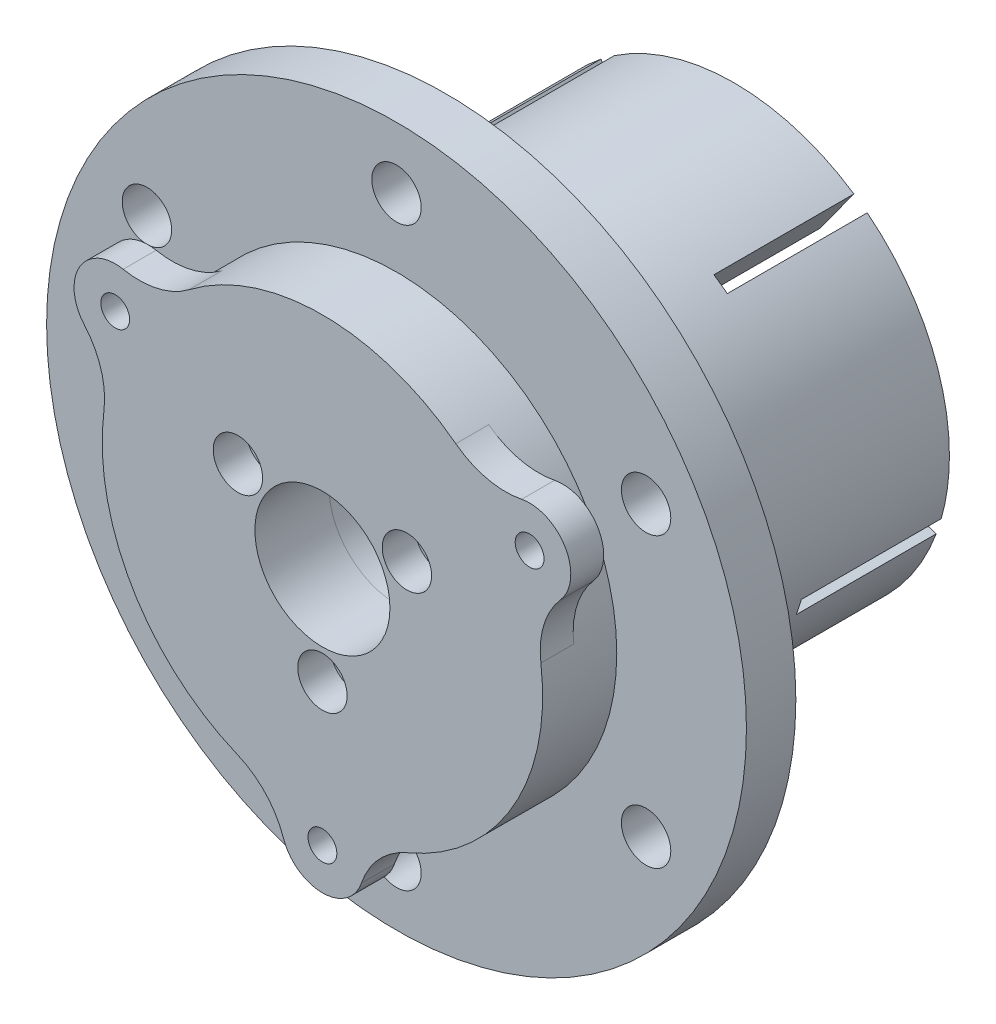
from build123d import *

# Parameters (mm, degrees)
SKETCH1_R               = 26.15
SKETCH1_R_2             = 19.15
BOSS_EXTRUDE1_DEPTH     = 35
FILLET1_R               = 0.7
SKETCH2_R               = 42.5
SKETCH2_R_2             = 3
SKETCH2_R_3             = 8.2
SKETCH2_R_4             = 1.35
BOSS_EXTRUDE2_DEPTH     = 6
SKETCH3_W               = 2
SKETCH3_H               = 27.522885867
CUT_EXTRUDE1_DEPTH      = 17
CIRPATTERN1_COUNT       = 5
CHAMFER1_SIZE           = 8
SKETCH4_R               = 8
CUT_EXTRUDE2_DEPTH      = 70.552138716
SKETCH7_R               = 2.4
CUT_EXTRUDE3_DEPTH      = 3
CHAMFER2_SIZE           = 0.923009594
CHAMFER2_SIZE_2         = 1.1
SKETCH9_R               = 26.75
SKETCH9_R_2             = 2.4
SKETCH9_R_3             = 8.2
SKETCH9_R_4             = 1.75
BOSS_EXTRUDE3_DEPTH     = 9
SHELL1_T                = -4
BOSS_EXTRUDE4_START     = 5
BOSS_EXTRUDE4_OUTLINE_R = 1.75
BOSS_EXTRUDE4_DEPTH     = 4
FILLET2_R               = 10
SKETCH10_R              = 3
CUT_EXTRUDE4_DEPTH      = 4


# Read off the part's stored shape, not the designer's step: Boss-Extrude4
with BuildPart() as part:
    # Sketch1 → Boss-Extrude1 (new body)
    # profile 1 of 3: a face of its own
    with BuildSketch(Plane.XY):
        Circle(SKETCH1_R)
        Circle(SKETCH1_R_2, mode=Mode.SUBTRACT)
    # profile 2 of 3: a face of its own
    with BuildSketch(Plane.XY):
        with BuildLine():
            Line((2.9, 18.929144196), (-2.9, 18.929144196))
            Line((-2.9, 18.929144196), (-2.9, 16.750820875))
            ThreePointArc((-2.9, 16.750820875), (0, 17), (2.9, 16.750820875))
            Line((2.9, 16.750820875), (2.9, 18.929144196))
        make_face()
    # profile 3 of 3: a face of its own
    with BuildSketch(Plane.XY):
        with BuildLine():
            ThreePointArc((2.9, 18.929144196), (0, 19.15), (-2.9, 18.929144196))
            Line((-2.9, 18.929144196), (2.9, 18.929144196))
        make_face()
    extrude(amount=-BOSS_EXTRUDE1_DEPTH)

    # Fillet1
    fillet1_edges = [part.edges().sort_by_distance(p)[0] for p in [
        (2.9, 18.929144196, -17.5),
        (-2.9, 18.929144196, -17.5),
    ]]
    fillet(fillet1_edges, radius=FILLET1_R)

    # Sketch2 → Boss-Extrude2 (add)
    with BuildSketch(Plane.XY):
        Circle(SKETCH2_R)
        with Locations((0, 35)):
            Circle(SKETCH2_R_2, mode=Mode.SUBTRACT)
        with Locations((30.310889132, 17.5)):
            Circle(SKETCH2_R_2, mode=Mode.SUBTRACT)
        with Locations((30.310889132, -17.5)):
            Circle(SKETCH2_R_2, mode=Mode.SUBTRACT)
        with Locations((0, -35)):
            Circle(SKETCH2_R_2, mode=Mode.SUBTRACT)
        with Locations((-30.310889132, -17.5)):
            Circle(SKETCH2_R_2, mode=Mode.SUBTRACT)
        with Locations((-30.310889132, 17.5)):
            Circle(SKETCH2_R_2, mode=Mode.SUBTRACT)
        Circle(SKETCH2_R_3, mode=Mode.SUBTRACT)
        with Locations((0, -11.85)):
            Circle(SKETCH2_R_4, mode=Mode.SUBTRACT)
        with Locations((-10.262401035, 5.925)):
            Circle(SKETCH2_R_4, mode=Mode.SUBTRACT)
        with Locations((10.262401035, 5.925)):
            Circle(SKETCH2_R_4, mode=Mode.SUBTRACT)
    extrude(amount=BOSS_EXTRUDE2_DEPTH)

    # Sketch3 → Cut-Extrude1 (cut)
    with BuildSketch(Plane(origin=(0, 0, -35), x_dir=(-1, 0, 0), z_dir=(0, 0, -1))):
        with Locations((0, -13.761442934)):
            Rectangle(SKETCH3_W, SKETCH3_H)
    cut_extrude1 = extrude(amount=-CUT_EXTRUDE1_DEPTH, mode=Mode.SUBTRACT)

    # CirPattern1: Cut-Extrude1 ×5 about axis
    cirpattern1_axis = Axis((0, 0, 0), (0, 0, 1))
    for i in range(1, CIRPATTERN1_COUNT):
        add(cut_extrude1.rotate(cirpattern1_axis, i * 360 / CIRPATTERN1_COUNT), mode=Mode.SUBTRACT)

    # Chamfer1
    # the kernel refuses this chamfer: 8 mm, written as the material it adds along each edge
    with BuildSketch(Plane(origin=(0, 0, 0), x_dir=(1, 0, 0), z_dir=(0, -1, 0))) as chamfer1_piece_1_section:
        Polygon((26.15 + CHAMFER1_SIZE, 0), (26.15, -CHAMFER1_SIZE), (26.15, 0), align=None)
    chamfer1_piece_1 = revolve(axis=Axis((0, 0, 0), (0, 0, 1)), mode=Mode.PRIVATE)
    chamfer1_piece_1 = chamfer1_piece_1 - Plane(origin=(0, -35, -3.86937464), x_dir=(1, 0, 0), z_dir=(0, 0, -1)) * Cylinder(3, 137, mode=Mode.PRIVATE)
    chamfer1_piece_1 = chamfer1_piece_1 - Plane(origin=(-30.310889132, -17.5, -3.86937464), x_dir=(1, 0, 0), z_dir=(0, 0, -1)) * Cylinder(3, 137, mode=Mode.PRIVATE)
    chamfer1_piece_1 = chamfer1_piece_1 - Plane(origin=(30.310889132, -17.5, -3.86937464), x_dir=(1, 0, 0), z_dir=(0, 0, -1)) * Cylinder(3, 137, mode=Mode.PRIVATE)
    chamfer1_piece_1 = chamfer1_piece_1 - Plane(origin=(-30.310889132, 17.5, -3.86937464), x_dir=(1, 0, 0), z_dir=(0, 0, -1)) * Cylinder(3, 137, mode=Mode.PRIVATE)
    chamfer1_piece_1 = chamfer1_piece_1 - Plane(origin=(0, 35, -3.86937464), x_dir=(1, 0, 0), z_dir=(0, 0, -1)) * Cylinder(3, 137, mode=Mode.PRIVATE)
    chamfer1_piece_1 = chamfer1_piece_1 - Plane(origin=(30.310889132, 17.5, -3.86937464), x_dir=(1, 0, 0), z_dir=(0, 0, -1)) * Cylinder(3, 137, mode=Mode.PRIVATE)
    add(chamfer1_piece_1)

    # Sketch4 → Cut-Extrude2 (cut, through all)
    with BuildSketch(Plane(origin=(0, 0, 0), x_dir=(-1, 0, 0), z_dir=(0, 0, -1))):
        with Locations((0, 35)):
            Circle(SKETCH4_R)
        with Locations((30.310889132, 17.5)):
            Circle(SKETCH4_R)
        with Locations((30.310889132, -17.5)):
            Circle(SKETCH4_R)
        with Locations((0, -35)):
            Circle(SKETCH4_R)
        with Locations((-30.310889132, -17.5)):
            Circle(SKETCH4_R)
        with Locations((-30.310889132, 17.5)):
            Circle(SKETCH4_R)
    extrude(amount=CUT_EXTRUDE2_DEPTH, mode=Mode.SUBTRACT)

    # Sketch7 → Cut-Extrude3 (cut)
    with BuildSketch(Plane.XY.offset(6)):
        with Locations((-10.262401035, 5.925)):
            Circle(SKETCH7_R)
        with Locations((10.262401035, 5.925)):
            Circle(SKETCH7_R)
        with Locations((0, -11.85)):
            Circle(SKETCH7_R)
    extrude(amount=-CUT_EXTRUDE3_DEPTH, mode=Mode.SUBTRACT)

    # Chamfer2
    # the kernel refuses this chamfer: 1.1, 0.923009594 mm, written as the material it adds along each edge
    with BuildSketch(Plane(origin=(-10.262401035, 5.925, 3), x_dir=(1, 0, 0), z_dir=(0, -1, 0))) as chamfer2_piece_1_section:
        Polygon((2.4, CHAMFER2_SIZE), (2.4 - CHAMFER2_SIZE_2, 0), (2.4, 0), align=None)
    chamfer2_piece_1 = revolve(axis=Axis((-10.262401035, 5.925, 3), (0, 0, 1)), mode=Mode.PRIVATE)
    chamfer2_piece_1 = chamfer2_piece_1 - Plane(origin=(-10.262401035, 5.925, 3.481852419), x_dir=(1, 0, 0), z_dir=(0, 0, -1)) * Cylinder(1.35, 10, mode=Mode.PRIVATE)
    add(chamfer2_piece_1)
    with BuildSketch(Plane(origin=(0, -11.85, 3), x_dir=(1, 0, 0), z_dir=(0, -1, 0))) as chamfer2_piece_2_section:
        Polygon((2.4, CHAMFER2_SIZE), (2.4 - CHAMFER2_SIZE_2, 0), (2.4, 0), align=None)
    chamfer2_piece_2 = revolve(axis=Axis((0, -11.85, 3), (0, 0, 1)), mode=Mode.PRIVATE)
    chamfer2_piece_2 = chamfer2_piece_2 - Plane(origin=(0, -11.85, 3.481852419), x_dir=(1, 0, 0), z_dir=(0, 0, -1)) * Cylinder(1.35, 10, mode=Mode.PRIVATE)
    add(chamfer2_piece_2)
    with BuildSketch(Plane(origin=(10.262401035, 5.925, 3), x_dir=(1, 0, 0), z_dir=(0, -1, 0))) as chamfer2_piece_3_section:
        Polygon((2.4, CHAMFER2_SIZE), (2.4 - CHAMFER2_SIZE_2, 0), (2.4, 0), align=None)
    chamfer2_piece_3 = revolve(axis=Axis((10.262401035, 5.925, 3), (0, 0, 1)), mode=Mode.PRIVATE)
    chamfer2_piece_3 = chamfer2_piece_3 - Plane(origin=(10.262401035, 5.925, 3.481852419), x_dir=(1, 0, 0), z_dir=(0, 0, -1)) * Cylinder(1.35, 10, mode=Mode.PRIVATE)
    add(chamfer2_piece_3)


with BuildPart() as body_2:
    # Sketch9 → Boss-Extrude3 (new body)
    # profile 1 of 4: a face of its own
    with BuildSketch(Plane.XY.offset(6)):
        Circle(SKETCH9_R)
        with Locations((-10.262401035, 5.925)):
            Circle(SKETCH9_R_2, mode=Mode.SUBTRACT)
        with Locations((0, -11.85)):
            Circle(SKETCH9_R_2, mode=Mode.SUBTRACT)
        Circle(SKETCH9_R_3, mode=Mode.SUBTRACT)
        with Locations((10.262401035, 5.925)):
            Circle(SKETCH9_R_2, mode=Mode.SUBTRACT)
    # profile 2 of 4: a face of its own
    with BuildSketch(Plane.XY.offset(6)):
        with Locations((-10.262401035, 5.925)):
            Circle(SKETCH9_R_2)
        with Locations((-10.262401035, 5.925)):
            Circle(SKETCH9_R_4, mode=Mode.SUBTRACT)
    # profile 3 of 4: a face of its own
    with BuildSketch(Plane.XY.offset(6)):
        with Locations((10.262401035, 5.925)):
            Circle(SKETCH9_R_2)
        with Locations((10.262401035, 5.925)):
            Circle(SKETCH9_R_4, mode=Mode.SUBTRACT)
    # profile 4 of 4: a face of its own
    with BuildSketch(Plane.XY.offset(6)):
        with Locations((0, -11.85)):
            Circle(SKETCH9_R_2)
        with Locations((0, -11.85)):
            Circle(SKETCH9_R_4, mode=Mode.SUBTRACT)
    extrude(amount=BOSS_EXTRUDE3_DEPTH)

    # Shell1
    shell1_openings = [body_2.faces().sort_by_distance(p)[0] for p in [
        (-25.993395744, 0, 6),
    ]]
    offset(amount=SHELL1_T, openings=shell1_openings)

    # Boss-Extrude4 outline → Boss-Extrude4 (add)
    # profile 1 of 3: a face of its own
    with BuildSketch(Plane.XY.offset(6).offset(BOSS_EXTRUDE4_START)):
        with BuildLine():
            ThreePointArc((-24.99409118, 9.53194136), (-23.166179551, 13.375), (-20.751948955, 16.879547226))
            ThreePointArc((-20.751948955, 16.879547226), (-29.495127019, 17.029019524), (-24.99409118, 9.53194136))
        make_face()
        with Locations((-25.165, 14.529019524)):
            Circle(BOSS_EXTRUDE4_OUTLINE_R, mode=Mode.SUBTRACT)
    # profile 2 of 3: a face of its own
    with BuildSketch(Plane.XY.offset(6).offset(BOSS_EXTRUDE4_START)):
        with BuildLine():
            ThreePointArc((24.99409118, 9.53194136), (29.495127019, 17.029019524), (20.751948955, 16.879547226))
            ThreePointArc((20.751948955, 16.879547226), (23.166179551, 13.375), (24.99409118, 9.53194136))
        make_face()
        with Locations((25.165, 14.529019524)):
            Circle(BOSS_EXTRUDE4_OUTLINE_R, mode=Mode.SUBTRACT)
    # profile 3 of 3: a face of its own
    with BuildSketch(Plane.XY.offset(6).offset(BOSS_EXTRUDE4_START)):
        with BuildLine():
            ThreePointArc((4.242142224, -26.411488586), (0, -26.75), (-4.242142224, -26.411488586))
            ThreePointArc((-4.242142224, -26.411488586), (0, -34.058039048), (4.242142224, -26.411488586))
        make_face()
        with Locations((0, -29.058039048)):
            Circle(BOSS_EXTRUDE4_OUTLINE_R, mode=Mode.SUBTRACT)
    extrude(amount=BOSS_EXTRUDE4_DEPTH)

    # Fillet2
    fillet2_edges = [body_2.edges().sort_by_distance(p)[0] for p in [
        (-24.99409118, 9.53194136, 13),
        (-20.751948955, 16.879547226, 13),
        (20.751948955, 16.879547226, 13),
        (24.99409118, 9.53194136, 13),
        (4.242142224, -26.411488586, 13),
        (-4.242142224, -26.411488586, 13),
    ]]
    fillet(fillet2_edges, radius=FILLET2_R)

    # Sketch10 → Cut-Extrude4 (cut)
    with BuildSketch(Plane.XY.offset(15)):
        with Locations((-10.262401035, 5.925)):
            Circle(SKETCH10_R)
        with Locations((10.262401035, 5.925)):
            Circle(SKETCH10_R)
        with Locations((0, -11.85)):
            Circle(SKETCH10_R)
    extrude(amount=-CUT_EXTRUDE4_DEPTH, mode=Mode.SUBTRACT)


solid = Compound([part.part, body_2.part])
